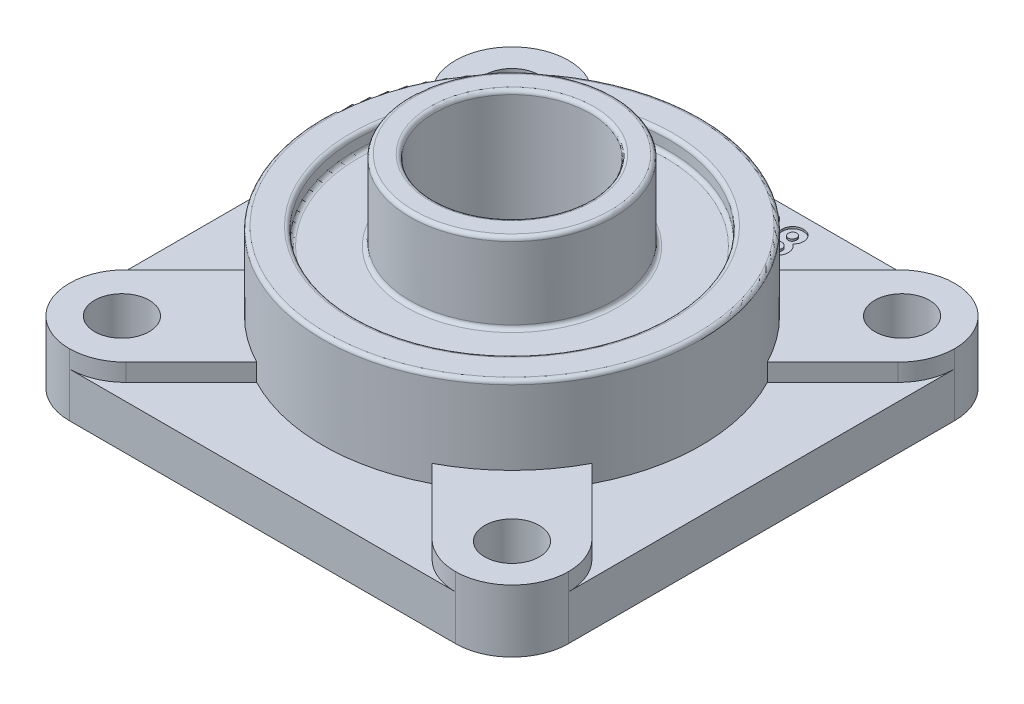
from build123d import *

# Parameters (mm, degrees)
ESBO_O1_W                = 128
ESBO_O1_H                = 128
RESSALTO_EXTRUS_O1_DEPTH = 11.5
RESSALTO_EXTRUS_O2_DEPTH = 4.5
ESBO_O3_R                = 48.5
RESSALTO_EXTRUS_O3_DEPTH = 36
ESBO_O5_R                = 26.15
RESSALTO_EXTRUS_O4_DEPTH = 52
CORTE_EXTRUS_O1_START    = -4.5
ESBO_O6_R                = 40.25
ESBO_O6_R_2              = 26.15
CORTE_EXTRUS_O1_DEPTH    = 4.5
ESBO_O7_R                = 20
CORTE_EXTRUS_O2_DEPTH    = 105.383906806
CORTE_EXTRUS_O3_DEPTH    = 98.406365295
FILETE4_R                = 14.5
FILETE5_R                = 1
CORTE_EXTRUS_O4_DEPTH    = 0.5
FILETE6_R                = 1


with BuildPart() as part:
    # Esboço1 → Ressalto-extrusão1 (new body)
    with BuildSketch(Plane(origin=(0, 0, 0), x_dir=(1, 0, 0), z_dir=(0, 1, 0))):
        Rectangle(ESBO_O1_W, ESBO_O1_H)
    extrude(amount=RESSALTO_EXTRUS_O1_DEPTH)

    # Esboço2 → Ressalto-extrusão2 (add)
    with BuildSketch(Plane(origin=(0, 11.5, 0), x_dir=(1, 0, 0), z_dir=(0, 1, 0))):
        Polygon((-10.253048327, 10.253048327), (-64, 64), (-64, 43.493903346), (-20.506096654, 0), align=None)
        Polygon((-43.493903346, 64), (-64, 64), (-10.253048327, 10.253048327), (0, 20.506096654), align=None)
        Polygon((43.493903346, 64), (0, 20.506096654), (10.253048327, 10.253048327), (64, 64), align=None)
        Polygon((64, 64), (10.253048327, 10.253048327), (20.506096654, 0), (64, 43.493903346), align=None)
        Polygon((0, 0), (-10.253048327, 10.253048327), (-20.506096654, 0), (-10.253048327, -10.253048327), align=None)
        Polygon((0, 20.506096654), (-10.253048327, 10.253048327), (0, 0), (10.253048327, 10.253048327), align=None)
        Polygon((10.253048327, 10.253048327), (0, 0), (10.253048327, -10.253048327), (20.506096654, 0), align=None)
        Polygon((10.253048327, -10.253048327), (0, 0), (-10.253048327, -10.253048327), (0, -20.506096654), align=None)
        Polygon((-10.253048327, -10.253048327), (-20.506096654, 0), (-64, -43.493903346), (-64, -64), align=None)
        Polygon((0, -20.506096654), (-10.253048327, -10.253048327), (-64, -64), (-43.493903346, -64), align=None)
        Polygon((64, -64), (10.253048327, -10.253048327), (0, -20.506096654), (43.493903346, -64), align=None)
        Polygon((20.506096654, 0), (10.253048327, -10.253048327), (64, -64), (64, -43.493903346), align=None)
    extrude(amount=RESSALTO_EXTRUS_O2_DEPTH)

    # Esboço3 → Ressalto-extrusão3 (add)
    with BuildSketch(Plane.XZ):
        with Locations(Location((0, 0, 0), (0, 0, 270))):
            Circle(ESBO_O3_R)
    extrude(amount=-RESSALTO_EXTRUS_O3_DEPTH)

    # Esboço5 → Ressalto-extrusão4 (add)
    with BuildSketch(Plane.XZ):
        with Locations(Location((0, 0, 0), (0, 0, 270))):
            Circle(ESBO_O5_R)
    extrude(amount=-RESSALTO_EXTRUS_O4_DEPTH)

    # Esboço6 → Corte-extrusão1 (cut)
    with BuildSketch(Plane(origin=(0, 36, 0), x_dir=(1, 0, 0), z_dir=(0, 1, 0)).offset(CORTE_EXTRUS_O1_START)):
        with Locations(Location((0, 0, 0), (0, 0, 270))):
            Circle(ESBO_O6_R)
        with Locations(Location((0, 0, 0), (0, 0, 90))):
            Circle(ESBO_O6_R_2, mode=Mode.SUBTRACT)
    extrude(amount=CORTE_EXTRUS_O1_DEPTH, mode=Mode.SUBTRACT)

    # Esboço7 → Corte-extrusão2 (cut, through all)
    with BuildSketch(Plane(origin=(0, 52, 0), x_dir=(1, 0, 0), z_dir=(0, 1, 0))):
        with Locations(Location((0, 0, 0), (0, 0, 270))):
            Circle(ESBO_O7_R)
    extrude(amount=-CORTE_EXTRUS_O2_DEPTH, mode=Mode.SUBTRACT)

    # Esboço8 → Corte-extrusão3 (cut, through all)
    with BuildSketch(Plane(origin=(0, 16, 0), x_dir=(1, 0, 0), z_dir=(0, 1, 0))):
        with BuildLine():
            ThreePointArc((-50, -43), (-54.949747468, -54.949747468), (-43, -50))
            Line((-43, -50), (-50, -50))
            Line((-50, -50), (-50, -43))
        make_face()
        with BuildLine():
            Line((-50, -50), (-43, -50))
            ThreePointArc((-43, -50), (-45.050252532, -45.050252532), (-50, -43))
            Line((-50, -43), (-50, -50))
        make_face()
        with BuildLine():
            ThreePointArc((-43, 50), (-54.949747468, 54.949747468), (-50, 43))
            Line((-50, 43), (-50, 50))
            Line((-50, 50), (-43, 50))
        make_face()
        with BuildLine():
            Line((-50, 50), (-50, 43))
            ThreePointArc((-50, 43), (-45.050252532, 45.050252532), (-43, 50))
            Line((-43, 50), (-50, 50))
        make_face()
        with BuildLine():
            ThreePointArc((43, 50), (45.050252532, 45.050252532), (50, 43))
            Line((50, 43), (50, 50))
            Line((50, 50), (43, 50))
        make_face()
        with BuildLine():
            Line((50, 50), (50, 43))
            ThreePointArc((50, 43), (54.949747468, 45.050252532), (57, 50))
            ThreePointArc((57, 50), (50, 57), (43, 50))
            Line((43, 50), (50, 50))
        make_face()
        with BuildLine():
            ThreePointArc((50, -43), (45.050252532, -45.050252532), (43, -50))
            Line((43, -50), (50, -50))
            Line((50, -50), (50, -43))
        make_face()
        with BuildLine():
            Line((50, -50), (43, -50))
            ThreePointArc((43, -50), (50, -57), (57, -50))
            ThreePointArc((57, -50), (54.949747468, -45.050252532), (50, -43))
            Line((50, -43), (50, -50))
        make_face()
    extrude(amount=-CORTE_EXTRUS_O3_DEPTH, mode=Mode.SUBTRACT)

    # Filete4
    filete4_edges = [part.edges().sort_by_distance(p)[0] for p in [
        (64, 8, 64),
        (-64, 8, 64),
        (-64, 8, -64),
        (64, 8, -64),
        (43.493903346, 13.75, -64),
        (-43.493903346, 13.75, -64),
        (-64, 13.75, -43.493903346),
        (-64, 13.75, 43.493903346),
        (-43.493903346, 13.75, 64),
        (43.493903346, 13.75, 64),
        (64, 13.75, 43.493903346),
        (64, 13.75, -43.493903346),
    ]]
    fillet(filete4_edges, radius=FILETE4_R - 0.0001)  # a hair under: the kernel refuses the full size

    # Filete5
    filete5_edges = [part.edges().sort_by_distance(p)[0] for p in [
        (0, 36, -40.25),
        (0, 52, -20),
        (0, 36, 48.5),
        (0, 52, 26.15),
    ]]
    fillet(filete5_edges, radius=FILETE5_R)

    # Esboço9 → Corte-extrusão4 (cut)
    # profile 1 of 4: a face of its own
    with BuildSketch(Plane(origin=(0, 11.5, 0), x_dir=(1, 0, 0), z_dir=(0, 1, 0))):
        Polygon((-13.5673169, 60.857243767), (-8.926932285, 60.857243767), (-8.926932285, 59.147628382), (-11.857701516, 59.147628382), (-11.857701516, 57.315897613), (-8.926932285, 57.315897613), (-8.926932285, 55.606282228), (-11.857701516, 55.606282228), (-11.857701516, 51.332243767), (-13.5673169, 51.332243767), align=None)
    # profile 2 of 4: a face of its own
    with BuildSketch(Plane(origin=(0, 11.5, 0), x_dir=(1, 0, 0), z_dir=(0, 1, 0))):
        with BuildLine():
            Line((-2.4548169, 57.682243767), (-4.164432285, 57.682243767))
            add(Edge.make_bspline(
                [(-4.164432285, 57.682243767), (-4.157048718, 57.811567126), (-4.142621672, 58.064257205), (-4.08523453, 58.431297637), (-4.008337729, 58.778110483), (-3.90570874, 59.103482555), (-3.776748699, 59.407295624), (-3.624776082, 59.690585403), (-3.445908333, 59.951860367), (-3.243952346, 60.1898605), (-3.022336778, 60.403372615), (-2.785662586, 60.59268587), (-2.530309519, 60.748902404), (-2.260943087, 60.877454148), (-1.977609157, 60.980161018), (-1.677626945, 61.048828872), (-1.36359386, 61.095331416), (-1.148612783, 61.099400575), (-1.03904166, 61.101474536)],
                knots=[0, 0, 0, 0, 1.199038563, 2.342849363, 3.436047546, 4.486744587, 5.497670872, 6.488682221, 7.459191391, 8.424610317, 9.374430501, 10.305433194, 11.225809216, 12.140057399, 13.06607119, 14.010487599, 14.985989317, 16, 16, 16, 16], degree=3))
            add(Edge.make_bspline(
                [(-1.03904166, 61.101474536), (-0.904544661, 61.097277875), (-0.641974999, 61.089085009), (-0.260440454, 61.019197146), (0.095871095, 60.902298896), (0.426700644, 60.738961211), (0.729231782, 60.531457804), (1.003414341, 60.284043952), (1.240956603, 59.991528782), (1.443364657, 59.666083373), (1.611541559, 59.321482487), (1.729392927, 58.965150882), (1.806855362, 58.606544152), (1.81511721, 58.365076531), (1.819221561, 58.245119368)],
                knots=[0, 0, 0, 0, 1.075374347, 2.099382735, 3.09057751, 4.06680945, 5.040638231, 6.016817125, 7.011024321, 8.044445721, 9.0776792, 10.070479129, 11.0414456, 12, 12, 12, 12], degree=3))
            add(Edge.make_bspline(
                [(1.819221561, 58.245119368), (1.817623544, 58.172560797), (1.814407129, 58.026518317), (1.792042971, 57.805520201), (1.758492315, 57.580407783), (1.707906103, 57.351374074), (1.644820948, 57.118354873), (1.568289538, 56.880652833), (1.47653665, 56.639615639), (1.371093454, 56.392530458), (1.245299454, 56.138595101), (1.098829826, 55.874002977), (0.927796934, 55.598988802), (0.734266641, 55.311999755), (0.517299016, 55.013488463), (0.275834894, 54.704354135), (0.012655376, 54.38350748), (-0.174130532, 54.169039496), (-0.270096347, 54.058851339)],
                knots=[0, 0, 0, 0, 0.728284026, 1.46585585, 2.227944881, 3.01186502, 3.81876927, 4.650621989, 5.517437689, 6.406905708, 7.346299482, 8.360816762, 9.441613733, 10.596154504, 11.834900912, 13.145207542, 14.533280747, 16, 16, 16, 16], degree=3))
            Line((-0.270096347, 54.058851339), (-1.2641919, 52.919743767))
            Line((-1.2641919, 52.919743767), (1.941336946, 52.919743767))
            Line((1.941336946, 52.919743767), (1.941336946, 51.332243767))
            Line((1.941336946, 51.332243767), (-4.408663054, 51.332243767))
            Line((-4.408663054, 51.332243767), (-4.408663054, 52.198499776))
            Line((-4.408663054, 52.198499776), (-1.588560891, 55.199866964))
            add(Edge.make_bspline(
                [(-1.588560891, 55.199866964), (-1.506911686, 55.287417777), (-1.34878139, 55.456977738), (-1.123778275, 55.705994579), (-0.920170332, 55.942305618), (-0.742179536, 56.16842709), (-0.580465161, 56.377024534), (-0.442238037, 56.574385338), (-0.326233494, 56.758725289), (-0.20029411, 56.981007076), (-0.080693094, 57.246117662), (0.029048077, 57.551535926), (0.095942915, 57.843445448), (0.105176518, 58.033659967), (0.109606177, 58.124912036)],
                knots=[0, 0, 0, 0, 1.246127091, 2.413378631, 3.493388633, 4.492180848, 5.408488754, 6.240484944, 6.999099869, 7.674939598, 8.898438119, 10.020720584, 11.050475521, 12, 12, 12, 12], degree=3))
            add(Edge.make_bspline(
                [(0.109606177, 58.124912036), (0.106294228, 58.213191373), (0.099876796, 58.384246741), (0.029354422, 58.627572093), (-0.079901286, 58.847878359), (-0.233858009, 59.038582541), (-0.420347819, 59.195296813), (-0.635854312, 59.311856485), (-0.878620477, 59.379110882), (-1.048804183, 59.38752873), (-1.136352357, 59.391859151)],
                knots=[0, 0, 0, 0, 1.062038974, 2.057870785, 3.028805853, 4.01125022, 4.991535629, 5.949134679, 6.94496649, 8, 8, 8, 8], degree=3))
            add(Edge.make_bspline(
                [(-1.136352357, 59.391859151), (-1.181580859, 59.390259442), (-1.270620428, 59.387110156), (-1.401501635, 59.366146216), (-1.526044506, 59.32919946), (-1.645635274, 59.279696008), (-1.758997633, 59.214078826), (-1.865845649, 59.133195195), (-1.967305099, 59.039100552), (-2.062910651, 58.932089118), (-2.149924184, 58.812664327), (-2.227209286, 58.681916879), (-2.291111199, 58.539927934), (-2.347372766, 58.388571962), (-2.390764378, 58.226223276), (-2.422358855, 58.053853516), (-2.446378026, 57.871743105), (-2.451952769, 57.746559322), (-2.4548169, 57.682243767)],
                knots=[0, 0, 0, 0, 0.903469896, 1.778625579, 2.63899355, 3.493148037, 4.358286772, 5.247621495, 6.164656832, 7.118446693, 8.109501108, 9.111810964, 10.146451449, 11.215617525, 12.33435995, 13.498009769, 14.714554818, 16, 16, 16, 16], degree=3))
        make_face()
    # profile 3 of 4: a face of its own
    with BuildSketch(Plane(origin=(0, 11.5, 0), x_dir=(1, 0, 0), z_dir=(0, 1, 0))):
        with BuildLine():
            add(Edge.make_bspline(
                [(6.247812306, 61.101474536), (6.330564787, 61.100246052), (6.493278273, 61.097830524), (6.73292461, 61.071668393), (6.96377029, 61.03214471), (7.186718411, 60.977022953), (7.40016417, 60.904071272), (7.605661068, 60.81674936), (7.800763098, 60.710477003), (7.987958434, 60.590436918), (8.167174969, 60.454534524), (8.334105358, 60.299598778), (8.491798105, 60.129194758), (8.636839742, 59.940746261), (8.772442262, 59.735967426), (8.898160096, 59.51482578), (9.013030844, 59.276238985), (9.118341933, 59.01977649), (9.212511441, 58.741594035), (9.291830301, 58.438500745), (9.359859496, 58.110427405), (9.417280936, 57.756557389), (9.460682264, 57.37642032), (9.489935633, 56.970268742), (9.51001068, 56.538885656), (9.511649065, 56.242960404), (9.512490792, 56.090927661)],
                knots=[0, 0, 0, 0, 0.879237366, 1.728815576, 2.559023295, 3.367336655, 4.166867292, 4.954216142, 5.737608147, 6.525189134, 7.316157332, 8.124696809, 8.942788509, 9.781158001, 10.649253743, 11.551476218, 12.482711956, 13.461909668, 14.496590415, 15.601789533, 16.789733467, 18.056700938, 19.410929216, 20.8549011, 22.384193279, 24, 24, 24, 24], degree=3))
            add(Edge.make_bspline(
                [(9.512490792, 56.090927661), (9.511581113, 55.936992818), (9.509813622, 55.637900178), (9.490770159, 55.202571443), (9.457976415, 54.793470961), (9.415709472, 54.410641057), (9.357815321, 54.054283896), (9.290013222, 53.723476753), (9.209442338, 53.418339537), (9.112170916, 53.139559788), (9.007497278, 52.882646889), (8.892312309, 52.644525281), (8.768623667, 52.424549999), (8.639268398, 52.219402416), (8.497154768, 52.035130178), (8.349199849, 51.865467067), (8.188961421, 51.716875767), (8.023186139, 51.58169855), (7.845800985, 51.464878308), (7.658635286, 51.36270925), (7.458352201, 51.279838009), (7.248602552, 51.20776103), (7.025811113, 51.156017536), (6.793518008, 51.114960774), (6.549100696, 51.092270289), (6.382691546, 51.089455385), (6.297421681, 51.088012997)],
                knots=[0, 0, 0, 0, 1.643780988, 3.193836972, 4.651895693, 6.025988579, 7.305620092, 8.505800249, 9.631074763, 10.672816429, 11.65661981, 12.592235626, 13.49536222, 14.350718032, 15.179365177, 15.97804903, 16.751647189, 17.51006938, 18.259804725, 19.016521909, 19.783502495, 20.571750527, 21.382245291, 22.22305063, 23.089471752, 24, 24, 24, 24], degree=3))
            add(Edge.make_bspline(
                [(6.297421681, 51.088012997), (6.212154118, 51.089483208), (6.045116216, 51.092363328), (5.800037976, 51.11479206), (5.566513835, 51.156183857), (5.341959757, 51.208158278), (5.127938603, 51.279678531), (4.923424149, 51.36502922), (4.729988933, 51.466560794), (4.547097364, 51.583653217), (4.375373886, 51.717925996), (4.212149917, 51.867942933), (4.057786518, 52.033323774), (3.914631939, 52.21592092), (3.780341721, 52.413297082), (3.656316301, 52.627706198), (3.542630213, 52.858836095), (3.435727336, 53.107008942), (3.342842268, 53.377567618), (3.26017887, 53.672928177), (3.192463189, 53.995552693), (3.138001707, 54.345337519), (3.094519691, 54.72154162), (3.062174069, 55.124346581), (3.043024828, 55.553940016), (3.041275873, 55.849220984), (3.040375407, 56.001249175)],
                knots=[0, 0, 0, 0, 0.917216111, 1.796812873, 2.643793957, 3.46689424, 4.273913431, 5.068098542, 5.848489301, 6.620921603, 7.401012384, 8.190319798, 9.003608147, 9.831726257, 10.68377682, 11.569763213, 12.493818149, 13.453288342, 14.474581811, 15.568529029, 16.750744269, 18.018426408, 19.375425659, 20.823733699, 22.36466933, 24, 24, 24, 24], degree=3))
            add(Edge.make_bspline(
                [(3.040375407, 56.001249175), (3.042006517, 56.212480379), (3.045153764, 56.620053709), (3.085037988, 57.208878668), (3.143577913, 57.753145343), (3.229559195, 58.251943311), (3.335873863, 58.707119973), (3.47201533, 59.115676864), (3.627002486, 59.483267284), (3.759071455, 59.701030063), (3.82267709, 59.805906627)],
                knots=[0, 0, 0, 0, 1.288568992, 2.486310467, 3.599230591, 4.627010532, 5.572937695, 6.447898582, 7.252493626, 8, 8, 8, 8], degree=3))
            add(Edge.make_bspline(
                [(3.82267709, 59.805906627), (3.896634693, 59.908937332), (4.041236379, 60.110382661), (4.294076469, 60.374842723), (4.565720227, 60.601021918), (4.86174706, 60.783801608), (5.177475181, 60.927941687), (5.515615275, 61.029746201), (5.87491865, 61.089062255), (6.12165827, 61.097275324), (6.247812306, 61.101474536)],
                knots=[0, 0, 0, 0, 1.058512271, 2.069600068, 3.047294572, 4.004278952, 4.967380941, 5.939006123, 6.946246673, 8, 8, 8, 8], degree=3))
        make_face()
        with BuildLine():
            add(Edge.make_bspline(
                [(6.28978947, 59.391859151), (6.214980541, 59.388313357), (6.068315331, 59.381361717), (5.855497122, 59.322352107), (5.654822838, 59.231208581), (5.502175271, 59.121531599), (5.387920085, 59.016393058), (5.308089167, 58.921246099), (5.231104829, 58.815068949), (5.163108385, 58.69307038), (5.098901992, 58.559633945), (5.036152993, 58.414153923), (4.984715291, 58.253057009), (4.934179112, 58.079086704), (4.889904704, 57.887433192), (4.852812456, 57.676529917), (4.819673793, 57.445005355), (4.79655918, 57.192707858), (4.775009425, 56.91990139), (4.75956154, 56.625978246), (4.753103166, 56.311017719), (4.751050246, 56.094109078), (4.749990792, 55.982168646)],
                knots=[0, 0, 0, 0, 1.076674018, 2.110852608, 3.161083442, 4.239746716, 4.804137807, 5.395870207, 6.026861976, 6.692161227, 7.405688833, 8.16177676, 8.973626916, 9.841385931, 10.773283133, 11.807421078, 12.927755683, 14.143907515, 15.458935494, 16.872852025, 18.386167141, 20, 20, 20, 20], degree=3))
            add(Edge.make_bspline(
                [(4.749990792, 55.982168646), (4.751734525, 55.837144406), (4.755078263, 55.559049674), (4.772591197, 55.159139765), (4.807694422, 54.795189546), (4.851355746, 54.464732392), (4.912679857, 54.169911406), (4.983237218, 53.907937308), (5.070369284, 53.682149631), (5.171067176, 53.489282978), (5.282594628, 53.325211717), (5.403662584, 53.185750406), (5.530149112, 53.064983491), (5.66600227, 52.966886014), (5.810897952, 52.891708629), (5.963626545, 52.837634465), (6.124285107, 52.804533417), (6.234302434, 52.799943366), (6.28978947, 52.797628382)],
                knots=[0, 0, 0, 0, 1.771748488, 3.397459088, 4.888034009, 6.237357457, 7.467047327, 8.564189669, 9.548206622, 10.417051504, 11.216568818, 11.965764335, 12.669334354, 13.348544111, 14.005342236, 14.656555988, 15.322436492, 16, 16, 16, 16], degree=3))
            add(Edge.make_bspline(
                [(6.28978947, 52.797628382), (6.343372366, 52.799212466), (6.448281015, 52.802313905), (6.601261321, 52.834149764), (6.745930368, 52.885907955), (6.881851355, 52.959123551), (7.009510454, 53.052228382), (7.128283745, 53.165631593), (7.237275464, 53.300463548), (7.300774534, 53.400528799), (7.333494398, 53.452090521)],
                knots=[0, 0, 0, 0, 0.992283464, 1.942767638, 2.88273346, 3.832339453, 4.79467288, 5.803907806, 6.868395428, 8, 8, 8, 8], degree=3))
            add(Edge.make_bspline(
                [(7.333494398, 53.452090521), (7.372016527, 53.522547967), (7.452794308, 53.670291517), (7.546270496, 53.919603248), (7.624953541, 54.200785676), (7.692674887, 54.514713865), (7.738992157, 54.862625989), (7.778880533, 55.242315906), (7.798119688, 55.655695581), (7.801249041, 55.942086511), (7.802875407, 56.090927661)],
                knots=[0, 0, 0, 0, 0.710965849, 1.490837728, 2.352621235, 3.297892224, 4.334225155, 5.461620853, 6.680770821, 8, 8, 8, 8], degree=3))
            add(Edge.make_bspline(
                [(7.802875407, 56.090927661), (7.802247177, 56.241060824), (7.801037941, 56.530041534), (7.778851966, 56.944907337), (7.7479563, 57.323818396), (7.70276486, 57.665928755), (7.644617858, 57.972068909), (7.572951458, 58.242218845), (7.488462105, 58.476910977), (7.3882678, 58.675911284), (7.277296382, 58.845034246), (7.159496835, 58.990128629), (7.034371054, 59.114006553), (6.902128289, 59.217134192), (6.759707736, 59.295931443), (6.609829813, 59.35156882), (6.452187258, 59.385227568), (6.344652719, 59.389618787), (6.28978947, 59.391859151)],
                knots=[0, 0, 0, 0, 1.793836731, 3.452829483, 4.963243077, 6.335886805, 7.574563692, 8.684454726, 9.672768357, 10.54971625, 11.340229787, 12.085688095, 12.778991901, 13.440269426, 14.083255152, 14.715733572, 15.344777694, 16, 16, 16, 16], degree=3))
        make_face(mode=Mode.SUBTRACT)
    # profile 4 of 4: a face of its own
    with BuildSketch(Plane(origin=(0, 11.5, 0), x_dir=(1, 0, 0), z_dir=(0, 1, 0))):
        with BuildLine():
            add(Edge.make_bspline(
                [(15.534305696, 56.46108992), (15.634187318, 56.389721803), (15.831893977, 56.248455053), (16.092992154, 55.995370389), (16.317888711, 55.71305151), (16.50422199, 55.403230106), (16.653506591, 55.073521665), (16.760371717, 54.727450377), (16.828251217, 54.368068677), (16.835665685, 54.123391592), (16.839413869, 53.999701699)],
                knots=[0, 0, 0, 0, 1.013736912, 2.006600758, 2.994453809, 3.989973287, 4.987781207, 5.978959008, 6.978317308, 8, 8, 8, 8], degree=3))
            add(Edge.make_bspline(
                [(16.839413869, 53.999701699), (16.83489197, 53.865767317), (16.825923365, 53.600125659), (16.746628906, 53.21056221), (16.619324835, 52.836304085), (16.445338977, 52.481482149), (16.227192712, 52.157122908), (15.972922951, 51.869972544), (15.682209167, 51.627530483), (15.4115464, 51.463035109), (15.178577501, 51.353763942), (14.990573644, 51.283832588), (14.792053929, 51.222267817), (14.581601746, 51.17308165), (14.359255367, 51.134683773), (14.125332102, 51.109325888), (13.879677969, 51.090892251), (13.712152237, 51.088988931), (13.626252811, 51.088012997)],
                knots=[0, 0, 0, 0, 1.313679292, 2.605514271, 3.884962679, 5.186178731, 6.472827995, 7.711026938, 8.938935107, 10.174644318, 10.808706728, 11.462743532, 12.142127587, 12.847854939, 13.582806024, 14.355735269, 15.156897313, 16, 16, 16, 16], degree=3))
            add(Edge.make_bspline(
                [(13.626252811, 51.088012997), (13.534649595, 51.089255556), (13.355766577, 51.091682027), (13.094637217, 51.106353754), (12.848315086, 51.13340273), (12.616283484, 51.169010612), (12.398765648, 51.21613016), (12.195755136, 51.275875167), (12.006761757, 51.343901504), (11.775423934, 51.44747744), (11.511046754, 51.609233445), (11.225302832, 51.84612045), (10.974492775, 52.128260274), (10.756437185, 52.447733296), (10.584557548, 52.802574115), (10.456742729, 53.181645435), (10.381049279, 53.58392002), (10.371936634, 53.859458333), (10.367298484, 53.999701699)],
                knots=[0, 0, 0, 0, 0.886964665, 1.7320671, 2.531131818, 3.285397207, 4.004107883, 4.684213108, 5.332925796, 5.947568694, 7.135706876, 8.320776993, 9.52873045, 10.778999824, 12.05415135, 13.333578234, 14.642845846, 16, 16, 16, 16], degree=3))
            add(Edge.make_bspline(
                [(10.367298484, 53.999701699), (10.371536976, 54.122040966), (10.379866125, 54.362452437), (10.439528949, 54.714731276), (10.541832561, 55.048733298), (10.682209039, 55.366783689), (10.863222125, 55.668917838), (11.085942224, 55.952912632), (11.34754547, 56.2213301), (11.5459241, 56.379844329), (11.64760197, 56.46108992)],
                knots=[0, 0, 0, 0, 1.01821053, 2.000906977, 2.963938143, 3.919209931, 4.888045165, 5.887808425, 6.917407893, 8, 8, 8, 8], degree=3))
            add(Edge.make_bspline(
                [(11.64760197, 56.46108992), (11.584567084, 56.533791439), (11.460470377, 56.676918834), (11.299888019, 56.90727097), (11.164604143, 57.144764263), (11.049741692, 57.387471331), (10.964832439, 57.639570983), (10.900621471, 57.897099698), (10.864303809, 58.162681102), (10.858627249, 58.34169086), (10.855760023, 58.43210855)],
                knots=[0, 0, 0, 0, 1.061529281, 2.089831458, 3.092927091, 4.075998741, 5.048384512, 6.024008542, 7.00192825, 8, 8, 8, 8], degree=3))
            add(Edge.make_bspline(
                [(10.855760023, 58.43210855), (10.859561528, 58.554507447), (10.867061753, 58.795995755), (10.933490803, 59.149108678), (11.043779157, 59.484636333), (11.193817077, 59.801596346), (11.384341917, 60.093080912), (11.610726674, 60.354477409), (11.876153874, 60.576210983), (12.170752992, 60.766468177), (12.496000698, 60.917796984), (12.848811074, 61.02368555), (13.224923884, 61.090718595), (13.484129606, 61.09783468), (13.616712547, 61.101474536)],
                knots=[0, 0, 0, 0, 1.022455555, 2.017265428, 2.990720743, 3.968117071, 4.939886797, 5.893155559, 6.847550415, 7.820889576, 8.817530429, 9.83499769, 10.892607882, 12, 12, 12, 12], degree=3))
            add(Edge.make_bspline(
                [(13.616712547, 61.101474536), (13.747385947, 61.097828723), (14.002171716, 61.090720152), (14.371674847, 61.024131269), (14.716860923, 60.915884015), (15.034875508, 60.761359981), (15.326427897, 60.570736088), (15.58734396, 60.341281958), (15.813018316, 60.073374958), (16.005124633, 59.774349771), (16.158203848, 59.452193458), (16.27137477, 59.114345683), (16.336834169, 58.763461963), (16.346227458, 58.525228473), (16.35095233, 58.40539581)],
                knots=[0, 0, 0, 0, 1.094655142, 2.134348324, 3.136019022, 4.118575226, 5.088726318, 6.048298823, 7.020513804, 8.015920439, 9.020015034, 10.003048569, 10.995523219, 12, 12, 12, 12], degree=3))
            add(Edge.make_bspline(
                [(16.35095233, 58.40539581), (16.348676246, 58.320704564), (16.3442096, 58.154504325), (16.31118412, 57.909644469), (16.255573266, 57.674701107), (16.178039143, 57.443996626), (16.070240245, 57.211261499), (15.924363273, 56.972036097), (15.746923091, 56.716380559), (15.607570451, 56.549059233), (15.534305696, 56.46108992)],
                knots=[0, 0, 0, 0, 0.940746401, 1.846144481, 2.739104268, 3.619506754, 4.545839139, 5.581956076, 6.728711598, 8, 8, 8, 8], degree=3))
        make_face()
        with BuildLine():
            add(Edge.make_bspline(
                [(13.574735383, 59.391859151), (13.504346948, 59.388465777), (13.367425889, 59.381864915), (13.172055572, 59.322284824), (12.996411281, 59.224837348), (12.844502447, 59.090730442), (12.719929283, 58.928011803), (12.628374853, 58.740933476), (12.574081993, 58.531804218), (12.568334038, 58.385367947), (12.565375407, 58.309993166)],
                knots=[0, 0, 0, 0, 1.018099191, 1.980427864, 2.929421084, 3.909248076, 4.895556904, 5.880788387, 6.909183412, 8, 8, 8, 8], degree=3))
            add(Edge.make_bspline(
                [(12.565375407, 58.309993166), (12.569030221, 58.233974668), (12.576166596, 58.085541224), (12.632286175, 57.872393913), (12.727943548, 57.679221834), (12.859280474, 57.510059717), (13.018876107, 57.371892993), (13.197574293, 57.266368939), (13.397356825, 57.206127993), (13.536186512, 57.197959106), (13.607172282, 57.193782228)],
                knots=[0, 0, 0, 0, 1.07118507, 2.091592095, 3.082435519, 4.092579768, 5.090825648, 6.043203473, 6.999459622, 8, 8, 8, 8], degree=3))
            add(Edge.make_bspline(
                [(13.607172282, 57.193782228), (13.679500075, 57.197018593), (13.820408186, 57.203323638), (14.020689549, 57.265127668), (14.201117462, 57.363970619), (14.355627311, 57.503712684), (14.483608932, 57.672936063), (14.57681499, 57.869483994), (14.630461031, 58.089663595), (14.637622967, 58.243548923), (14.641336946, 58.323349536)],
                knots=[0, 0, 0, 0, 1.008803858, 1.965339183, 2.900766489, 3.864508618, 4.855158575, 5.849593072, 6.884859315, 8, 8, 8, 8], degree=3))
            add(Edge.make_bspline(
                [(14.641336946, 58.323349536), (14.637529018, 58.398674489), (14.63016462, 58.544350303), (14.577359068, 58.753493128), (14.480379029, 58.937651608), (14.352959769, 59.099359798), (14.193210166, 59.229767395), (14.007752578, 59.325669929), (13.797952637, 59.381294327), (13.650752397, 59.388261282), (13.574735383, 59.391859151)],
                knots=[0, 0, 0, 0, 1.065910571, 2.061433587, 3.023559535, 3.990682701, 4.956464619, 5.918590567, 6.925120432, 8, 8, 8, 8], degree=3))
        make_face(mode=Mode.SUBTRACT)
        with BuildLine():
            add(Edge.make_bspline(
                [(13.630068917, 55.484166844), (13.576579034, 55.483278564), (13.471151143, 55.481527777), (13.31616348, 55.461338575), (13.16743689, 55.431251671), (13.02515589, 55.389747635), (12.890039277, 55.33316719), (12.76094171, 55.264958419), (12.638309034, 55.184431815), (12.523960234, 55.093049341), (12.420615639, 54.992748369), (12.327459888, 54.888137707), (12.251318213, 54.776512886), (12.187910352, 54.661584349), (12.136961776, 54.542441352), (12.103280917, 54.417121854), (12.081595159, 54.287294759), (12.078483479, 54.198861807), (12.076913869, 54.154253983)],
                knots=[0, 0, 0, 0, 1.129580664, 2.226389355, 3.296443603, 4.333934503, 5.352185725, 6.386189251, 7.41493955, 8.447544828, 9.47401038, 10.455044306, 11.4018853, 12.322125673, 13.225630306, 14.132028716, 15.057747923, 16, 16, 16, 16], degree=3))
            add(Edge.make_bspline(
                [(12.076913869, 54.154253983), (12.077661973, 54.107732427), (12.079145744, 54.015462679), (12.101556036, 53.880787527), (12.133822896, 53.750902592), (12.179142734, 53.627023675), (12.239749405, 53.509222898), (12.312114871, 53.396354984), (12.398762486, 53.28921138), (12.497342828, 53.188366552), (12.607703083, 53.097386517), (12.726647252, 53.01723152), (12.852604355, 52.946562773), (12.989355534, 52.895664341), (13.131836348, 52.849077625), (13.283863901, 52.820814586), (13.443777715, 52.800017857), (13.553035122, 52.798438524), (13.609080335, 52.797628382)],
                knots=[0, 0, 0, 0, 0.973817353, 1.931446211, 2.852767904, 3.776304432, 4.688323523, 5.623710549, 6.581246645, 7.570897993, 8.57436511, 9.572506873, 10.574556662, 11.591826551, 12.624694332, 13.712108235, 14.826391851, 16, 16, 16, 16], degree=3))
            add(Edge.make_bspline(
                [(13.609080335, 52.797628382), (13.665733709, 52.798655292), (13.776133191, 52.800656413), (13.937515035, 52.818342538), (14.090153617, 52.846405274), (14.233866618, 52.886541522), (14.369197494, 52.937957656), (14.494330895, 53.003400219), (14.612123824, 53.077564854), (14.718790996, 53.164211329), (14.816185986, 53.2586379), (14.900105444, 53.362121392), (14.971461228, 53.47133415), (15.029017445, 53.587456216), (15.075460143, 53.709939449), (15.107316919, 53.840005137), (15.127085194, 53.976191641), (15.128884344, 54.068958503), (15.129798484, 54.116092925)],
                knots=[0, 0, 0, 0, 1.200705402, 2.339794563, 3.437264955, 4.487414319, 5.499029866, 6.500076882, 7.476298407, 8.444948224, 9.407950986, 10.347155707, 11.263432813, 12.167927724, 13.089546445, 14.03463663, 15.00140776, 16, 16, 16, 16], degree=3))
            add(Edge.make_bspline(
                [(15.129798484, 54.116092925), (15.128053016, 54.163843563), (15.12464123, 54.257179513), (15.105972441, 54.395011994), (15.070951698, 54.525679342), (15.025134336, 54.652212058), (14.964186724, 54.771991762), (14.888521583, 54.884765657), (14.80239608, 54.993327286), (14.701734395, 55.09284388), (14.591676497, 55.183837419), (14.474537405, 55.264902674), (14.350677924, 55.33355747), (14.219759256, 55.389679353), (14.081303055, 55.431273267), (13.936365746, 55.461337518), (13.785185082, 55.481532296), (13.682288615, 55.483279926), (13.630068917, 55.484166844)],
                knots=[0, 0, 0, 0, 1.011708178, 1.977538892, 2.938094892, 3.871441737, 4.823268678, 5.775953079, 6.743660653, 7.753304209, 8.767430709, 9.76505158, 10.765940967, 11.761741361, 12.775867861, 13.822051386, 14.89469657, 16, 16, 16, 16], degree=3))
        make_face(mode=Mode.SUBTRACT)
    extrude(amount=-CORTE_EXTRUS_O4_DEPTH, mode=Mode.SUBTRACT)

    # Filete6
    filete6_edges = [part.edges().sort_by_distance(p)[0] for p in [
        (0, 31.5, -40.25),
        (0, 31.5, 26.15),
    ]]
    fillet(filete6_edges, radius=FILETE6_R)


solid = part.part
